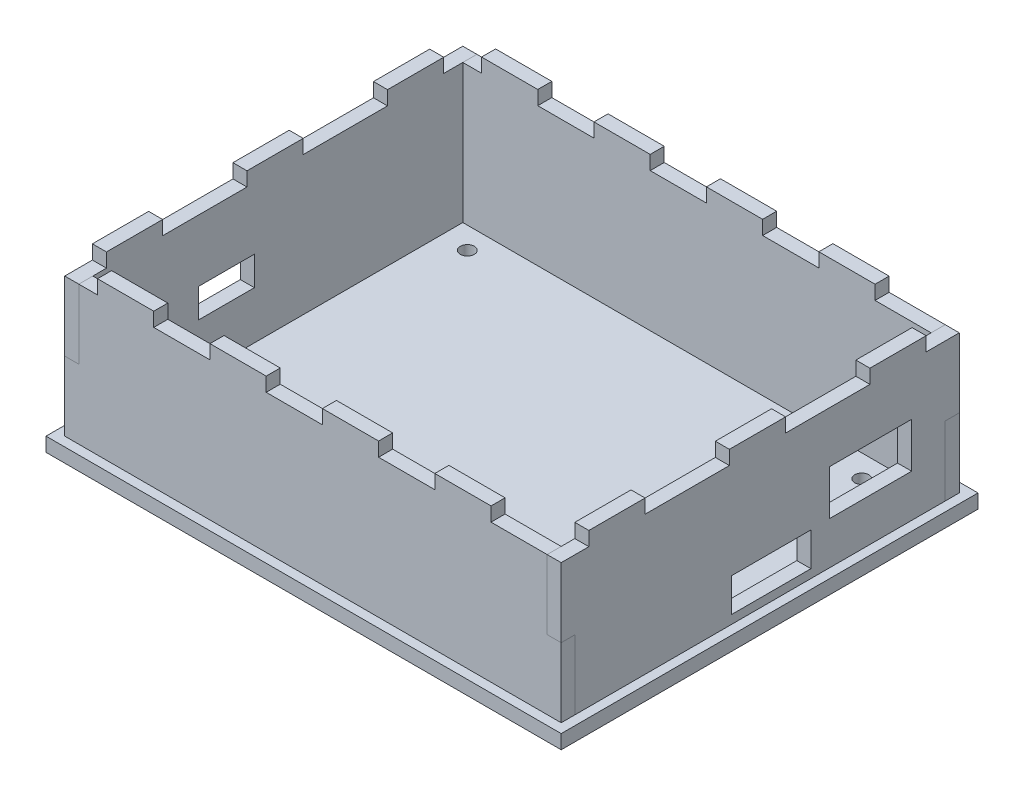
from build123d import *

# Parameters (mm, degrees)
SKETCH1_W              = 109.97478029
SKETCH1_H              = 88.97474981
SKETCH1_R              = 1.50000254
SKETCH1_W_2            = 3
SKETCH1_H_2            = 12
SKETCH1_W_3            = 12
SKETCH1_H_3            = 3
BOSS_EXTRUDE7_DEPTH    = 3
SKETCH1_9_W            = 12
SKETCH1_9_H            = 3
BOSS_EXTRUDE8_DEPTH    = 32.6
BOSS_EXTRUDE8_2_DEPTH  = 32.6
BOSS_EXTRUDE8_3_DEPTH  = 32.6
BOSS_EXTRUDE8_4_DEPTH  = 32.6
BOSS_EXTRUDE8_5_DEPTH  = 32.6
BOSS_EXTRUDE8_6_DEPTH  = 32.6
BOSS_EXTRUDE8_7_DEPTH  = 32.6
BOSS_EXTRUDE8_8_DEPTH  = 32.6
SKETCH11_W             = 99.97478029
SKETCH11_H             = 3
BOSS_EXTRUDE10_DEPTH   = 29.6
SKETCH13_W             = 3
SKETCH13_H             = 14.8
BOSS_EXTRUDE11_DEPTH   = 3
SKETCH14_W             = 3
SKETCH14_H             = 14.8
BOSS_EXTRUDE12_DEPTH   = 3
SKETCH19_W             = 12
SKETCH19_H             = 3
BOSS_EXTRUDE17_DEPTH   = 3
SKETCH1_10_W           = 3
SKETCH1_10_H           = 12
BOSS_EXTRUDE18_DEPTH   = 32.6
BOSS_EXTRUDE18_2_DEPTH = 32.6
BOSS_EXTRUDE18_3_DEPTH = 32.6
SKETCH23_W             = 3
SKETCH23_H             = 78.97474981
BOSS_EXTRUDE22_DEPTH   = 29.6
SKETCH24_W             = 3
SKETCH24_H             = 14.8
BOSS_EXTRUDE23_DEPTH   = 3
SKETCH25_W             = 3
SKETCH25_H             = 14.8
BOSS_EXTRUDE24_DEPTH   = 3
SKETCH26_W             = 3
SKETCH26_H             = 12
BOSS_EXTRUDE25_DEPTH   = 3
SKETCH29_W             = 16.899997478
SKETCH29_H             = 7.170342647
SKETCH29_W_2           = 17.499999673
SKETCH29_H_2           = 9.599999766
CUT_EXTRUDE4_DEPTH     = 10
SKETCH30_W             = 11.939331378
SKETCH30_H             = 6.199760673
CUT_EXTRUDE5_DEPTH     = 10


with BuildPart() as part:
    # Sketch1 → Boss-Extrude7 (new body)
    with BuildSketch(Plane(origin=(0, 0, 0), x_dir=(1, 0, 0), z_dir=(0, 1, 0))):
        with Locations((47.956716774, -41.662620739)):
            Rectangle(SKETCH1_W, SKETCH1_H)
        with Locations((87.908800848, -6.956551397)):
            Circle(SKETCH1_R, mode=Mode.SUBTRACT)
        with Locations((3.580632192, -6.829551143)):
            Circle(SKETCH1_R, mode=Mode.SUBTRACT)
        with Locations((3.8346327, -76.425690335)):
            Circle(SKETCH1_R, mode=Mode.SUBTRACT)
        with Locations((-3.530673371, -42.244450418)):
            Rectangle(SKETCH1_W_2, SKETCH1_H_2, mode=Mode.SUBTRACT)
        with Locations((-3.530673371, -12.244450418)):
            Rectangle(SKETCH1_W_2, SKETCH1_H_2, mode=Mode.SUBTRACT)
        with Locations((-3.530673371, -72.244450418)):
            Rectangle(SKETCH1_W_2, SKETCH1_H_2, mode=Mode.SUBTRACT)
        with Locations((99.444106919, -72.244450418)):
            Rectangle(SKETCH1_W_2, SKETCH1_H_2, mode=Mode.SUBTRACT)
        with Locations((99.444106919, -42.244450418)):
            Rectangle(SKETCH1_W_2, SKETCH1_H_2, mode=Mode.SUBTRACT)
        with Locations((99.444106919, -12.244450418)):
            Rectangle(SKETCH1_W_2, SKETCH1_H_2, mode=Mode.SUBTRACT)
        with Locations((7.969326629, -0.675245834)):
            Rectangle(SKETCH1_W_3, SKETCH1_H_3, mode=Mode.SUBTRACT)
        with Locations((31.969326629, -0.675245834)):
            Rectangle(SKETCH1_W_3, SKETCH1_H_3, mode=Mode.SUBTRACT)
        with Locations((55.969326629, -0.675245834)):
            Rectangle(SKETCH1_W_3, SKETCH1_H_3, mode=Mode.SUBTRACT)
        with Locations((79.969326629, -0.675245834)):
            Rectangle(SKETCH1_W_3, SKETCH1_H_3, mode=Mode.SUBTRACT)
        with Locations((79.969326629, -82.649995644)):
            Rectangle(SKETCH1_W_3, SKETCH1_H_3, mode=Mode.SUBTRACT)
        with Locations((55.969326629, -82.649995644)):
            Rectangle(SKETCH1_W_3, SKETCH1_H_3, mode=Mode.SUBTRACT)
        with Locations((31.969326629, -82.649995644)):
            Rectangle(SKETCH1_W_3, SKETCH1_H_3, mode=Mode.SUBTRACT)
        with Locations((7.969326629, -82.649995644)):
            Rectangle(SKETCH1_W_3, SKETCH1_H_3, mode=Mode.SUBTRACT)
    extrude(amount=BOSS_EXTRUDE7_DEPTH)


with BuildPart() as body_2:
    # Sketch1<9> → Boss-Extrude8 (new body)
    with BuildSketch(Plane(origin=(0, 0, 0), x_dir=(1, 0, 0), z_dir=(0, 1, 0))):
        with Locations((7.969326629, -0.675245834)):
            Rectangle(SKETCH1_9_W, SKETCH1_9_H)
    extrude(amount=BOSS_EXTRUDE8_DEPTH)



with BuildPart() as body_3:
    # Sketch1<9> → Boss-Extrude8 2 (new body)
    with BuildSketch(Plane(origin=(0, 0, 0), x_dir=(1, 0, 0), z_dir=(0, 1, 0))):
        with Locations((31.969326629, -0.675245834)):
            Rectangle(SKETCH1_9_W, SKETCH1_9_H)
    extrude(amount=BOSS_EXTRUDE8_2_DEPTH)


with BuildPart() as body_4:
    # Sketch1<9> → Boss-Extrude8 3 (new body)
    with BuildSketch(Plane(origin=(0, 0, 0), x_dir=(1, 0, 0), z_dir=(0, 1, 0))):
        with Locations((55.969326629, -0.675245834)):
            Rectangle(SKETCH1_9_W, SKETCH1_9_H)
    extrude(amount=BOSS_EXTRUDE8_3_DEPTH)


with BuildPart() as body_5:
    # Sketch1<9> → Boss-Extrude8 4 (new body)
    with BuildSketch(Plane(origin=(0, 0, 0), x_dir=(1, 0, 0), z_dir=(0, 1, 0))):
        with Locations((79.969326629, -0.675245834)):
            Rectangle(SKETCH1_9_W, SKETCH1_9_H)
    extrude(amount=BOSS_EXTRUDE8_4_DEPTH)


with BuildPart() as body_6:
    # Sketch1<9> → Boss-Extrude8 5 (new body)
    with BuildSketch(Plane(origin=(0, 0, 0), x_dir=(1, 0, 0), z_dir=(0, 1, 0))):
        with Locations((79.969326629, -82.649995644)):
            Rectangle(SKETCH1_9_W, SKETCH1_9_H)
    extrude(amount=BOSS_EXTRUDE8_5_DEPTH)


with BuildPart() as body_7:
    # Sketch1<9> → Boss-Extrude8 6 (new body)
    with BuildSketch(Plane(origin=(0, 0, 0), x_dir=(1, 0, 0), z_dir=(0, 1, 0))):
        with Locations((55.969326629, -82.649995644)):
            Rectangle(SKETCH1_9_W, SKETCH1_9_H)
    extrude(amount=BOSS_EXTRUDE8_6_DEPTH)


with BuildPart() as body_8:
    # Sketch1<9> → Boss-Extrude8 7 (new body)
    with BuildSketch(Plane(origin=(0, 0, 0), x_dir=(1, 0, 0), z_dir=(0, 1, 0))):
        with Locations((31.969326629, -82.649995644)):
            Rectangle(SKETCH1_9_W, SKETCH1_9_H)
    extrude(amount=BOSS_EXTRUDE8_7_DEPTH)


with BuildPart() as body_9:
    # Sketch1<9> → Boss-Extrude8 8 (new body)
    with BuildSketch(Plane(origin=(0, 0, 0), x_dir=(1, 0, 0), z_dir=(0, 1, 0))):
        with Locations((7.969326629, -82.649995644)):
            Rectangle(SKETCH1_9_W, SKETCH1_9_H)
    extrude(amount=BOSS_EXTRUDE8_8_DEPTH)


with BuildPart() as body_2_1:
    add(body_2.part)

    add(body_3.part)  # Boss-Extrude10 merges body 3

    add(body_4.part)  # Boss-Extrude10 merges body 4

    add(body_5.part)  # Boss-Extrude10 merges body 5
    # Sketch11 → Boss-Extrude10 (add)
    with BuildSketch(Plane(origin=(0, 32.6, 0), x_dir=(1, 0, 0), z_dir=(0, 1, 0))):
        with Locations((47.956716774, -0.675245834)):
            Rectangle(SKETCH11_W, SKETCH11_H)
    extrude(amount=-BOSS_EXTRUDE10_DEPTH)

    # Sketch13 → Boss-Extrude11 (add)
    with BuildSketch(Plane(origin=(97.944106919, 0, 0), x_dir=(0, 0, -1), z_dir=(1, 0, 0))):
        with Locations((-0.675245834, 10.4)):
            Rectangle(SKETCH13_W, SKETCH13_H)
    extrude(amount=BOSS_EXTRUDE11_DEPTH)

    # Sketch14 → Boss-Extrude12 (add)
    with BuildSketch(Plane.ZY.offset(2.030673371)):
        with Locations((0.675245834, 10.4)):
            Rectangle(SKETCH14_W, SKETCH14_H)
    extrude(amount=BOSS_EXTRUDE12_DEPTH)

    # Sketch19 → Boss-Extrude17 (add)
    with BuildSketch(Plane(origin=(0, 32.6, 0), x_dir=(1, 0, 0), z_dir=(0, 1, 0))):
        with Locations((79.969326629, -0.675245834)):
            Rectangle(SKETCH19_W, SKETCH19_H)
        with Locations((55.969326629, -0.675245834)):
            Rectangle(SKETCH19_W, SKETCH19_H)
        with Locations((31.969326629, -0.675245834)):
            Rectangle(SKETCH19_W, SKETCH19_H)
        with Locations((7.969326629, -0.675245834)):
            Rectangle(SKETCH19_W, SKETCH19_H)
    extrude(amount=BOSS_EXTRUDE17_DEPTH)


with BuildPart() as body_3_2:
    # Sketch1<10> → Boss-Extrude18 (new body)
    with BuildSketch(Plane(origin=(0, 0, 0), x_dir=(1, 0, 0), z_dir=(0, 1, 0))):
        with Locations((99.444106919, -72.244450418)):
            Rectangle(SKETCH1_10_W, SKETCH1_10_H)
    extrude(amount=BOSS_EXTRUDE18_DEPTH)



with BuildPart() as body_4_2:
    # Sketch1<10> → Boss-Extrude18 2 (new body)
    with BuildSketch(Plane(origin=(0, 0, 0), x_dir=(1, 0, 0), z_dir=(0, 1, 0))):
        with Locations((99.444106919, -42.244450418)):
            Rectangle(SKETCH1_10_W, SKETCH1_10_H)
    extrude(amount=BOSS_EXTRUDE18_2_DEPTH)


with BuildPart() as body_5_2:
    # Sketch1<10> → Boss-Extrude18 3 (new body)
    with BuildSketch(Plane(origin=(0, 0, 0), x_dir=(1, 0, 0), z_dir=(0, 1, 0))):
        with Locations((99.444106919, -12.244450418)):
            Rectangle(SKETCH1_10_W, SKETCH1_10_H)
    extrude(amount=BOSS_EXTRUDE18_3_DEPTH)


with BuildPart() as body_3_2_1:
    add(body_3_2.part)

    add(body_4_2.part)  # Boss-Extrude22 merges body 4 2

    add(body_5_2.part)  # Boss-Extrude22 merges body 5 2
    # Sketch23 → Boss-Extrude22 (add)
    with BuildSketch(Plane(origin=(0, 3, 0), x_dir=(1, 0, 0), z_dir=(0, 1, 0))):
        with Locations((99.444106919, -41.662620739)):
            Rectangle(SKETCH23_W, SKETCH23_H)
    extrude(amount=BOSS_EXTRUDE22_DEPTH)

    # Sketch24 → Boss-Extrude23 (add)
    with BuildSketch(Plane(origin=(0, 0, 2.175245834), x_dir=(-1, 0, 0), z_dir=(0, 0, -1))):
        with Locations((-99.444106919, 25.2)):
            Rectangle(SKETCH24_W, SKETCH24_H)
    extrude(amount=BOSS_EXTRUDE23_DEPTH)

    # Sketch25 → Boss-Extrude24 (add)
    with BuildSketch(Plane.XY.offset(81.149995644)):
        with Locations((99.444106919, 25.2)):
            Rectangle(SKETCH25_W, SKETCH25_H)
    extrude(amount=BOSS_EXTRUDE24_DEPTH)

    # Sketch26 → Boss-Extrude25 (add)
    with BuildSketch(Plane(origin=(0, 32.6, 0), x_dir=(1, 0, 0), z_dir=(0, 1, 0))):
        with Locations((99.444106919, -72.244450418)):
            Rectangle(SKETCH26_W, SKETCH26_H)
        with Locations((99.444106919, -42.244450418)):
            Rectangle(SKETCH26_W, SKETCH26_H)
        with Locations((99.444106919, -12.244450418)):
            Rectangle(SKETCH26_W, SKETCH26_H)
    extrude(amount=BOSS_EXTRUDE25_DEPTH)


with BuildPart() as body_4_3:
    # Mirror4: mirrored copy
    add(body_3_2_1.part.mirror(Plane.ZY.offset(-47.956716774)))

    # Sketch30 → Cut-Extrude5 (cut)
    with BuildSketch(Plane.ZY.offset(5.030673371)):
        with Locations((52.635601435, 16.299929792)):
            Rectangle(SKETCH30_W, SKETCH30_H)
    extrude(amount=-CUT_EXTRUDE5_DEPTH, mode=Mode.SUBTRACT)


with BuildPart() as body_5_3:
    # Mirror5: mirrored copy
    add(body_2_1.part.mirror(Plane.XY.offset(41.662620739)))


with BuildPart() as body_3_2_2:
    add(body_3_2_1.part)

    # Sketch29 → Cut-Extrude4 (cut)
    with BuildSketch(Plane(origin=(100.944106919, 0, 0), x_dir=(0, 0, -1), z_dir=(1, 0, 0))):
        with Locations((-39.296607277, 8.414828677)):
            Rectangle(SKETCH29_W, SKETCH29_H)
        with Locations((-18.089421603, 16.900050683)):
            Rectangle(SKETCH29_W_2, SKETCH29_H_2)
    extrude(amount=-CUT_EXTRUDE4_DEPTH, mode=Mode.SUBTRACT)


solid = Compound([part.part, body_2_1.part, body_4_3.part, body_5_3.part, body_3_2_2.part])
